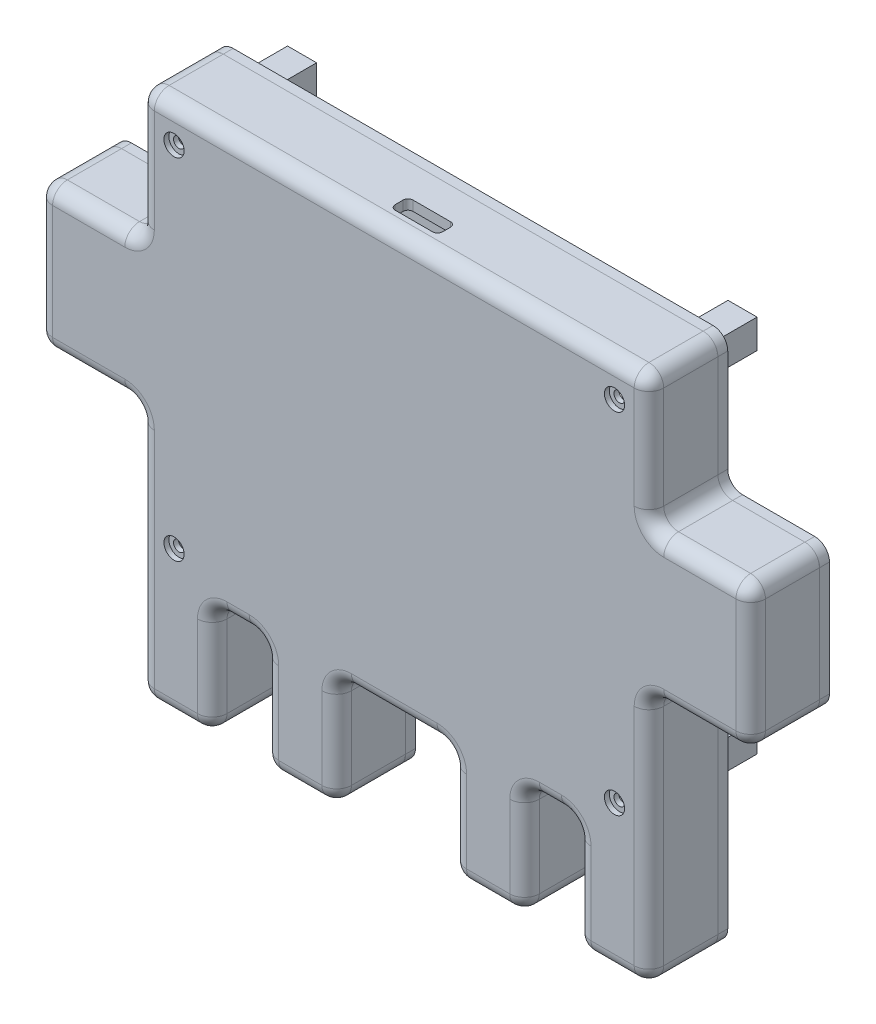
from build123d import *

# Parameters (mm, degrees)
PADTOP_W            = 20
PADTOP_H            = 19.412565414
PADTOP_W_2          = 77.3
PADTOP_H_2          = 39.1
PADTOP_R            = 4.5
PADTOP_W_3          = 11.1
PADTOP_H_3          = 11.1
EXTRUDE_1_DEPTH     = 3
EXTRUDE_START       = -2
PADTOP_8_W          = 14.1
PADTOP_8_H          = 14.1
PADTOP_8_W_2        = 1.194254246
PADTOP_8_W_3        = 20
PADTOP_8_H_2        = 20
PADTOP_8_R          = 4.5
EXTRUDE_4_DEPTH     = 2
EXTRUDE_6_DEPTH     = 14
FILLET_2_R          = 3
SHELL_1_T           = -2
FILLET_4_R          = 3
SKETCH_5_W          = 2
SKETCH_5_H          = 2
SKETCH_5_W_2        = 4
SKETCH_5_H_2        = 4
SKETCH_5_W_3        = 5.9
SKETCH_5_H_3        = 5.9
SKETCH_5_W_4        = 1.9
SKETCH_5_H_4        = 1.9
EXTRUDE_9_DEPTH     = 10
SKETCH_7_R          = 1.1
CUT_EXTRUDE_1_DEPTH = 2
SKETCH_7_4_R        = 2.05
SKETCH_7_4_R_2      = 1.1
CUT_EXTRUDE_2_DEPTH = 1
SKETCH_10_W         = 9.6
SKETCH_10_H         = 3.6
CUT_EXTRUDE_3_DEPTH = 2
FILLET_5_R          = 1
SKETCH_12_W         = 1
SKETCH_12_H         = 2
SKETCH_12_W_2       = 2
SKETCH_12_H_2       = 1
SKETCH_12_H_3       = 3
EXTRUDE_10_DEPTH    = 5


with BuildPart() as part:
    # padTop → 填料-伸長1 (new body)
    with BuildSketch(Plane.XY):
        Polygon((124.130335016, 70.452577029), (20.692697881, 70.452577029), (20.692697881, 43.50516343), (0.036952127, 43.50516343), (0.036952127, 14.309507688), (20.692697881, 14.309507688), (20.692697881, -37.135384775), (35.456274121, -37.135384775), (35.456274121, -14.488569064), (45.956274121, -14.488569064), (45.956274121, -37.135384775), (60.719850361, -37.135384775), (60.719850361, -14.488569064), (84.103182536, -14.488569064), (84.103182536, -37.135384775), (98.866758776, -37.135384775), (98.866758776, -14.488569064), (109.366758776, -14.488569064), (109.366758776, -37.135384775), (124.130335016, -37.135384775), (124.130335016, 14.486953202), (144.78608077, 14.486953202), (144.78608077, 43.682608944), (124.130335016, 43.682608944), align=None)
        with Locations((129.98608077, 29.084781073)):
            Rectangle(PADTOP_W, PADTOP_H, mode=Mode.SUBTRACT)
        with Locations((72.411516449, 11.013549732)):
            Rectangle(PADTOP_W_2, PADTOP_H_2, mode=Mode.SUBTRACT)
        with Locations((14.836952127, 29.084781073)):
            Circle(PADTOP_R, mode=Mode.SUBTRACT)
        with Locations((42.913258478, 51.226372894)):
            Rectangle(PADTOP_W_3, PADTOP_H_3, mode=Mode.SUBTRACT)
        with Locations((102.073451812, 51.226372894)):
            Rectangle(PADTOP_W_3, PADTOP_H_3, mode=Mode.SUBTRACT)
    extrude(amount=EXTRUDE_1_DEPTH)

    # padTop<8> → 填料-伸長4 (add)
    with BuildSketch(Plane.XY.offset(EXTRUDE_START)):
        Polygon((124.130335016, 70.452577029), (20.692697881, 70.452577029), (20.692697881, 43.50516343), (0.036952127, 43.50516343), (0.036952127, 14.309507688), (20.692697881, 14.309507688), (20.692697881, -37.135384775), (35.456274121, -37.135384775), (35.456274121, -14.488569064), (45.956274121, -14.488569064), (45.956274121, -37.135384775), (60.719850361, -37.135384775), (60.719850361, -14.488569064), (84.103182536, -14.488569064), (84.103182536, -37.135384775), (98.866758776, -37.135384775), (98.866758776, -14.488569064), (109.366758776, -14.488569064), (109.366758776, -37.135384775), (124.130335016, -37.135384775), (124.130335016, 14.486953202), (144.78608077, 14.486953202), (144.78608077, 43.682608944), (124.130335016, 43.682608944), align=None)
        with Locations((43.761516449, 1.463549732)):
            Rectangle(PADTOP_8_W, PADTOP_8_H, mode=Mode.SUBTRACT)
        with Locations((62.861516449, 1.463549732)):
            Rectangle(PADTOP_8_W, PADTOP_8_H, mode=Mode.SUBTRACT)
        with Locations((81.961516449, 1.463549732)):
            Rectangle(PADTOP_8_W, PADTOP_8_H, mode=Mode.SUBTRACT)
        with Locations((101.061516449, 1.463549732)):
            Rectangle(PADTOP_8_W, PADTOP_8_H, mode=Mode.SUBTRACT)
        with Locations((43.761516449, 20.563549732)):
            Rectangle(PADTOP_8_W, PADTOP_8_H, mode=Mode.SUBTRACT)
        with Locations((62.861516449, 20.563549732)):
            Rectangle(PADTOP_8_W, PADTOP_8_H, mode=Mode.SUBTRACT)
        with Locations((81.961516449, 20.563549732)):
            Rectangle(PADTOP_8_W, PADTOP_8_H, mode=Mode.SUBTRACT)
        with Locations((101.061516449, 20.563549732)):
            Rectangle(PADTOP_8_W, PADTOP_8_H, mode=Mode.SUBTRACT)
        with Locations((123.533207893, 29.084781073)):
            Rectangle(PADTOP_8_W_2, PADTOP_8_H, mode=Mode.SUBTRACT)
        with Locations((102.073451812, 51.226372894)):
            Rectangle(PADTOP_8_W_3, PADTOP_8_H_2, mode=Mode.SUBTRACT)
        with Locations((42.913258478, 51.226372894)):
            Rectangle(PADTOP_8_W_3, PADTOP_8_H_2, mode=Mode.SUBTRACT)
        with Locations((14.836952127, 29.084781073)):
            Circle(PADTOP_8_R, mode=Mode.SUBTRACT)
    extrude(amount=EXTRUDE_4_DEPTH)

    # 圓角4
    fillet_4_edges = [part.edges().sort_by_distance(p)[0] for p in [
        (35.456274121, -37.135384775, 0.5),
        (20.692697881, -37.135384775, 0.5),
        (35.456274121, -25.811976919, 3),
        (28.074486001, -37.135384775, 3),
        (60.719850361, -37.135384775, 0.5),
        (45.956274121, -37.135384775, 0.5),
        (45.956274121, -25.811976919, 3),
        (60.719850361, -25.811976919, 3),
        (53.338062241, -37.135384775, 3),
        (98.866758776, -37.135384775, 0.5),
        (84.103182536, -37.135384775, 0.5),
        (84.103182536, -25.811976919, 3),
        (98.866758776, -25.811976919, 3),
        (91.484970656, -37.135384775, 3),
        (124.130335016, -37.135384775, 0.5),
        (109.366758776, -37.135384775, 0.5),
        (109.366758776, -25.811976919, 3),
        (116.748546896, -37.135384775, 3),
        (134.458207893, 43.682608944, 3),
        (124.130335016, 57.067592987, 3),
        (72.411516449, 70.452577029, 3),
        (20.692697881, 56.97887023, 3),
        (10.364825004, 43.50516343, 3),
        (144.78608077, 43.682608944, 0.5),
        (144.78608077, 14.486953202, 0.5),
        (124.130335016, 14.486953202, 0.5),
        (0.036952127, 28.907335559, 3),
        (20.692697881, 14.309507688, 0.5),
        (0.036952127, 14.309507688, 0.5),
        (0.036952127, 43.50516343, 0.5),
        (20.692697881, 43.50516343, 0.5),
        (20.692697881, 70.452577029, 0.5),
        (124.130335016, 70.452577029, 0.5),
        (124.130335016, 43.682608944, 0.5),
        (10.364825004, 14.309507688, 3),
        (20.692697881, -11.412938543, 3),
        (124.130335016, -11.324215786, 3),
        (134.458207893, 14.486953202, 3),
        (40.706274121, -14.488569064, 3),
        (72.411516449, -14.488569064, 3),
        (144.78608077, 29.084781073, 3),
        (104.116758776, -14.488569064, 3),
        (109.366758776, -14.488569064, 0.5),
        (98.866758776, -14.488569064, 0.5),
        (84.103182536, -14.488569064, 0.5),
        (60.719850361, -14.488569064, 0.5),
        (45.956274121, -14.488569064, 0.5),
        (35.456274121, -14.488569064, 0.5),
    ]]
    fillet(fillet_4_edges, radius=FILLET_4_R)

    # 草圖5 → 填料-伸長9 (add)
    # profile 1 of 14: a face of its own
    with BuildSketch(Plane.XY.offset(-2)):
        with Locations((91.511516449, 11.013549732)):
            Rectangle(SKETCH_5_W, SKETCH_5_H)
    # profile 2 of 14: a face of its own
    with BuildSketch(Plane.XY.offset(-2)):
        with Locations((88.511516449, 11.013549732)):
            Rectangle(SKETCH_5_W_2, SKETCH_5_H)
    # profile 3 of 14: a face of its own
    with BuildSketch(Plane.XY.offset(-2)):
        with Locations((91.511516449, 14.013549732)):
            Rectangle(SKETCH_5_W, SKETCH_5_H_2)
    # profile 4 of 14: a face of its own
    with BuildSketch(Plane.XY.offset(-2)):
        with Locations((91.511516449, 8.013549732)):
            Rectangle(SKETCH_5_W, SKETCH_5_H_2)
    # profile 5 of 14: a face of its own
    with BuildSketch(Plane.XY.offset(-2)):
        with Locations((94.511516449, 11.013549732)):
            Rectangle(SKETCH_5_W_2, SKETCH_5_H)
    # profile 6 of 14: a face of its own
    with BuildSketch(Plane.XY.offset(-2)):
        with Locations((53.311516449, 11.013549732)):
            Rectangle(SKETCH_5_W, SKETCH_5_H)
    # profile 7 of 14: a face of its own
    with BuildSketch(Plane.XY.offset(-2)):
        with Locations((50.311516449, 11.013549732)):
            Rectangle(SKETCH_5_W_2, SKETCH_5_H)
    # profile 8 of 14: a face of its own
    with BuildSketch(Plane.XY.offset(-2)):
        with Locations((53.311516449, 14.013549732)):
            Rectangle(SKETCH_5_W, SKETCH_5_H_2)
    # profile 9 of 14: a face of its own
    with BuildSketch(Plane.XY.offset(-2)):
        with Locations((56.311516449, 11.013549732)):
            Rectangle(SKETCH_5_W_2, SKETCH_5_H)
    # profile 10 of 14: a face of its own
    with BuildSketch(Plane.XY.offset(-2)):
        with Locations((53.311516449, 8.013549732)):
            Rectangle(SKETCH_5_W, SKETCH_5_H_2)
    # profile 11 of 14: a face of its own
    with BuildSketch(Plane.XY.offset(-2)):
        with Locations((27.692697881, -7.488569064)):
            Rectangle(SKETCH_5_W_3, SKETCH_5_H_3)
        with Locations((27.692697881, -7.488569064)):
            Rectangle(SKETCH_5_W_4, SKETCH_5_H_4, mode=Mode.SUBTRACT)
    # profile 12 of 14: a face of its own
    with BuildSketch(Plane.XY.offset(-2)):
        with Locations((117.130335016, -7.488569064)):
            Rectangle(SKETCH_5_W_3, SKETCH_5_H_3)
        with Locations((117.130335016, -7.488569064)):
            Rectangle(SKETCH_5_W_4, SKETCH_5_H_4, mode=Mode.SUBTRACT)
    # profile 13 of 14: a face of its own
    with BuildSketch(Plane.XY.offset(-2)):
        with Locations((117.130335016, 63.452577029)):
            Rectangle(SKETCH_5_W_3, SKETCH_5_H_3)
        with Locations((117.130335016, 63.452577029)):
            Rectangle(SKETCH_5_W_4, SKETCH_5_H_4, mode=Mode.SUBTRACT)
    # profile 14 of 14: a face of its own
    with BuildSketch(Plane.XY.offset(-2)):
        with Locations((27.692697881, 63.452577029)):
            Rectangle(SKETCH_5_W_3, SKETCH_5_H_3)
        with Locations((27.692697881, 63.452577029)):
            Rectangle(SKETCH_5_W_4, SKETCH_5_H_4, mode=Mode.SUBTRACT)
    extrude(amount=-EXTRUDE_9_DEPTH)


with BuildPart() as body_2:
    # 草圖2 → 填料-伸長6 (new body)
    with BuildSketch(Plane.XY):
        Polygon((20.692697881, 43.50516343), (0.036952127, 43.50516343), (0.036952127, 14.309507688), (20.692697881, 14.309507688), (20.692697881, -37.135384775), (35.456274121, -37.135384775), (35.456274121, -14.488569064), (45.956274121, -14.488569064), (45.956274121, -37.135384775), (60.719850361, -37.135384775), (60.719850361, -14.488569064), (84.103182536, -14.488569064), (84.103182536, -37.135384775), (98.866758776, -37.135384775), (98.866758776, -14.488569064), (109.366758776, -14.488569064), (109.366758776, -37.135384775), (124.130335016, -37.135384775), (124.130335016, 14.486953202), (144.78608077, 14.486953202), (144.78608077, 43.682608944), (124.130335016, 43.682608944), (124.130335016, 70.452577029), (20.692697881, 70.452577029), align=None)
    extrude(amount=EXTRUDE_6_DEPTH)

    # 圓角2
    fillet_2_edges = [body_2.edges().sort_by_distance(p)[0] for p in [
        (0.036952127, 28.907335559, 14),
        (10.364825004, 14.309507688, 14),
        (20.692697881, -11.412938543, 14),
        (28.074486001, -37.135384775, 14),
        (35.456274121, -25.811976919, 14),
        (40.706274121, -14.488569064, 14),
        (45.956274121, -25.811976919, 14),
        (20.692697881, 70.452577029, 7),
        (124.130335016, 70.452577029, 7),
        (124.130335016, 43.682608944, 7),
        (144.78608077, 43.682608944, 7),
        (144.78608077, 14.486953202, 7),
        (124.130335016, 14.486953202, 7),
        (124.130335016, -37.135384775, 7),
        (109.366758776, -37.135384775, 7),
        (109.366758776, -14.488569064, 7),
        (98.866758776, -14.488569064, 7),
        (98.866758776, -37.135384775, 7),
        (53.338062241, -37.135384775, 14),
        (84.103182536, -37.135384775, 7),
        (84.103182536, -14.488569064, 7),
        (60.719850361, -14.488569064, 7),
        (60.719850361, -37.135384775, 7),
        (45.956274121, -37.135384775, 7),
        (45.956274121, -14.488569064, 7),
        (35.456274121, -14.488569064, 7),
        (35.456274121, -37.135384775, 7),
        (20.692697881, -37.135384775, 7),
        (20.692697881, 14.309507688, 7),
        (0.036952127, 14.309507688, 7),
        (0.036952127, 43.50516343, 7),
        (20.692697881, 43.50516343, 7),
        (60.719850361, -25.811976919, 14),
        (72.411516449, -14.488569064, 14),
        (20.692697881, 56.97887023, 14),
        (84.103182536, -25.811976919, 14),
        (91.484970656, -37.135384775, 14),
        (98.866758776, -25.811976919, 14),
        (104.116758776, -14.488569064, 14),
        (109.366758776, -25.811976919, 14),
        (116.748546896, -37.135384775, 14),
        (124.130335016, -11.324215786, 14),
        (134.458207893, 14.486953202, 14),
        (144.78608077, 29.084781073, 14),
        (134.458207893, 43.682608944, 14),
        (10.364825004, 43.50516343, 14),
        (124.130335016, 57.067592987, 14),
        (72.411516449, 70.452577029, 14),
    ]]
    fillet(fillet_2_edges, radius=FILLET_2_R)

    # 薄殼1
    shell_1_openings = [body_2.faces().sort_by_distance(p)[0] for p in [
        (72.411516449, 21.765183813, 0),
    ]]
    offset(amount=SHELL_1_T, openings=shell_1_openings, kind=Kind.INTERSECTION)

    # 草圖7 → 除料-伸長1 (cut)
    with BuildSketch(Plane.XY.offset(14)):
        with Locations((27.692697881, 63.452577029)):
            Circle(SKETCH_7_R)
        with Locations((117.130335016, 63.452577029)):
            Circle(SKETCH_7_R)
        with Locations((117.130335016, -7.488569064)):
            Circle(SKETCH_7_R)
        with Locations((27.692697881, -7.488569064)):
            Circle(SKETCH_7_R)
    extrude(amount=-CUT_EXTRUDE_1_DEPTH, mode=Mode.SUBTRACT)

    # 草圖7<4> → 除料-伸長2 (cut)
    # profile 1 of 4: a face of its own
    with BuildSketch(Plane.XY.offset(14)):
        with Locations((27.692697881, 63.452577029)):
            Circle(SKETCH_7_4_R)
        with Locations((27.692697881, 63.452577029)):
            Circle(SKETCH_7_4_R_2, mode=Mode.SUBTRACT)
    # profile 2 of 4: a face of its own
    with BuildSketch(Plane.XY.offset(14)):
        with Locations((117.130335016, 63.452577029)):
            Circle(SKETCH_7_4_R)
        with Locations((117.130335016, 63.452577029)):
            Circle(SKETCH_7_4_R_2, mode=Mode.SUBTRACT)
    # profile 3 of 4: a face of its own
    with BuildSketch(Plane.XY.offset(14)):
        with Locations((117.130335016, -7.488569064)):
            Circle(SKETCH_7_4_R)
        with Locations((117.130335016, -7.488569064)):
            Circle(SKETCH_7_4_R_2, mode=Mode.SUBTRACT)
    # profile 4 of 4: a face of its own
    with BuildSketch(Plane.XY.offset(14)):
        with Locations((27.692697881, -7.488569064)):
            Circle(SKETCH_7_4_R)
        with Locations((27.692697881, -7.488569064)):
            Circle(SKETCH_7_4_R_2, mode=Mode.SUBTRACT)
    extrude(amount=-CUT_EXTRUDE_2_DEPTH, mode=Mode.SUBTRACT)

    # 草圖10 → 除料-伸長3 (cut)
    with BuildSketch(Plane(origin=(0, 70.452577029, 0), x_dir=(1, 0, 0), z_dir=(0, 1, 0))):
        with Locations((72.411516449, -8.2)):
            Rectangle(SKETCH_10_W, SKETCH_10_H)
    extrude(amount=-CUT_EXTRUDE_3_DEPTH, mode=Mode.SUBTRACT)

    # 圓角5
    fillet_5_edges = [body_2.edges().sort_by_distance(p)[0] for p in [
        (67.611516449, 69.452577029, 6.4),
        (67.611516449, 69.452577029, 10),
        (77.211516449, 69.452577029, 10),
        (77.211516449, 69.452577029, 6.4),
    ]]
    fillet(fillet_5_edges, radius=FILLET_5_R)

    # 草圖12 → 填料-伸長10 (add)
    with BuildSketch(Plane(origin=(0, 0, 12), x_dir=(-1, 0, 0), z_dir=(0, 0, -1))):
        with Locations((-84.661516449, 15.552577029)):
            Rectangle(SKETCH_12_W, SKETCH_12_H)
        with Locations((-83.161516449, 14.052577029)):
            Rectangle(SKETCH_12_W_2, SKETCH_12_H_2)
        with Locations((-84.661516449, 14.052577029)):
            Rectangle(SKETCH_12_W, SKETCH_12_H_2)
        with Locations((-61.661516449, 14.052577029)):
            Rectangle(SKETCH_12_W_2, SKETCH_12_H_2)
        with Locations((-60.161516449, 14.052577029)):
            Rectangle(SKETCH_12_W, SKETCH_12_H_2)
        with Locations((-60.161516449, 15.552577029)):
            Rectangle(SKETCH_12_W, SKETCH_12_H)
        with Locations((-60.161516449, 66.452577029)):
            Rectangle(SKETCH_12_W, SKETCH_12_H_3)
        with Locations((-84.661516449, 66.452577029)):
            Rectangle(SKETCH_12_W, SKETCH_12_H_3)
        with Locations((-20.836952127, 35.734781073)):
            Rectangle(SKETCH_12_W_2, SKETCH_12_H_2)
        with Locations((-21.336952127, 35.234781073)):
            Rectangle(SKETCH_12_W, SKETCH_12_H)
        with Locations((-8.836952127, 35.734781073)):
            Rectangle(SKETCH_12_W_2, SKETCH_12_H_2)
        with Locations((-8.336952127, 35.234781073)):
            Rectangle(SKETCH_12_W, SKETCH_12_H)
        with Locations((-8.336952127, 22.934781073)):
            Rectangle(SKETCH_12_W, SKETCH_12_H)
        with Locations((-8.836952127, 22.434781073)):
            Rectangle(SKETCH_12_W_2, SKETCH_12_H_2)
        with Locations((-20.836952127, 22.434781073)):
            Rectangle(SKETCH_12_W_2, SKETCH_12_H_2)
        with Locations((-21.336952127, 22.934781073)):
            Rectangle(SKETCH_12_W, SKETCH_12_H)
    extrude(amount=EXTRUDE_10_DEPTH)


solid = Compound([part.part, body_2.part])
